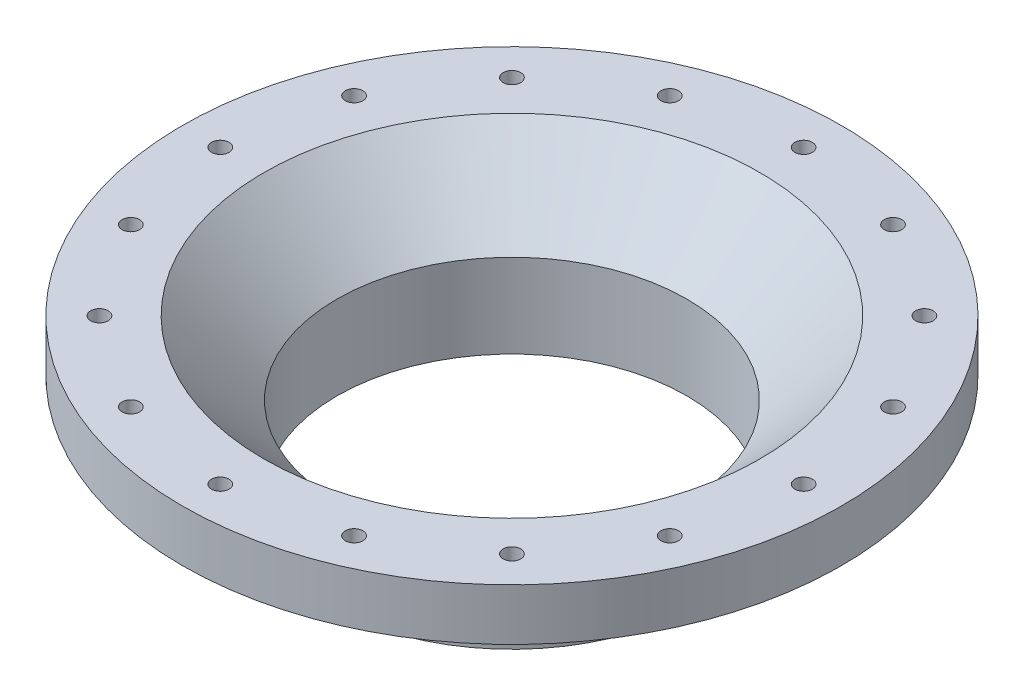
from build123d import *

# Parameters (mm, degrees)
SKETCH1_W               = 1.666666667
SKETCH1_H               = 2.3
SKETCH2_R               = 15
CUT_EXTRUDE2_DEPTH      = 130
FILLET1_R               = 10
SKETCH3_W               = 40
SKETCH3_H               = 40
BOSS_EXTRUDE1_DEPTH     = 60
SKETCH4_R               = 10
CUT_EXTRUDE3_DEPTH      = 340
FILLET2_R               = 20
FILLET3_R               = 10
CUT_EXTRUDE4_DEPTH      = 826.203065437
CUT_EXTRUDE4_DEPTH_BACK = 826.203065437
SKETCH5_W               = 1129.925764392
SKETCH5_H               = 112.630670772
SKETCH7_R               = 1.1


with BuildPart() as part:
    # Sketch1 → Revolve1 (revolve)
    with BuildSketch(Plane.XY, mode=Mode.PRIVATE) as revolve1_sk:
        Polygon((564.962882196, 62.614305474), (425.228610948, 62.614305474), (300, -62.614305474), (300, -206.383096907), (320, -206.383096907), (320, -106.383096907), (318.333333333, -106.383096907), (318.333333333, -104.083096907), (320, -104.083096907), (320, -70.898576722), (364.962882196, -25.935694526), (564.962882196, -25.935694526), align=None)
        with Locations((319.166666667, -55.233096907)):
            Rectangle(SKETCH1_W, SKETCH1_H, mode=Mode.SUBTRACT)
    revolve(revolve1_sk.sketch.rotate(Axis((0, 21.088092429, 0), (0, -1, 0)), 90), axis=Axis((0, 21.088092429, 0), (0, -1, 0)))

    # Sketch2 → Cut-Extrude2 (cut)
    with BuildSketch(Plane(origin=(0, 62.614305474, 0), x_dir=(1, 0, 0), z_dir=(0, 1, 0))):
        with Locations(Location((500, 0, 0), (0, 0, 270))):
            Circle(SKETCH2_R)
        with Locations(Location((461.939766256, -191.341716183, 0), (0, 0, 270))):
            Circle(SKETCH2_R)
        with Locations(Location((353.553390593, -353.553390593, 0), (0, 0, 270))):
            Circle(SKETCH2_R)
        with Locations(Location((191.341716183, -461.939766256, 0), (0, 0, 270))):
            Circle(SKETCH2_R)
        with Locations(Location((0, -500, 0), (0, 0, 270))):
            Circle(SKETCH2_R)
        with Locations(Location((-191.341716183, -461.939766256, 0), (0, 0, 270))):
            Circle(SKETCH2_R)
        with Locations(Location((-353.553390593, -353.553390593, 0), (0, 0, 270))):
            Circle(SKETCH2_R)
        with Locations(Location((-461.939766256, -191.341716183, 0), (0, 0, 270))):
            Circle(SKETCH2_R)
        with Locations(Location((-500, 0, 0), (0, 0, 270))):
            Circle(SKETCH2_R)
        with Locations(Location((-461.939766256, 191.341716183, 0), (0, 0, 270))):
            Circle(SKETCH2_R)
        with Locations(Location((-353.553390593, 353.553390593, 0), (0, 0, 270))):
            Circle(SKETCH2_R)
        with Locations(Location((-191.341716183, 461.939766256, 0), (0, 0, 270))):
            Circle(SKETCH2_R)
        with Locations(Location((0, 500, 0), (0, 0, 270))):
            Circle(SKETCH2_R)
        with Locations(Location((191.341716183, 461.939766256, 0), (0, 0, 270))):
            Circle(SKETCH2_R)
        with Locations(Location((353.553390593, 353.553390593, 0), (0, 0, 270))):
            Circle(SKETCH2_R)
        with Locations(Location((461.939766256, 191.341716183, 0), (0, 0, 270))):
            Circle(SKETCH2_R)
    extrude(amount=-CUT_EXTRUDE2_DEPTH, mode=Mode.SUBTRACT)

    # Fillet1
    fillet1_edges = [part.edges().sort_by_distance(p)[0] for p in [
        (0, -25.935694526, -364.962882196),
        (0, -70.898576722, -320),
    ]]
    fillet(fillet1_edges, radius=FILLET1_R)

    # Sketch3 → Boss-Extrude1 (add)
    with BuildSketch(Plane(origin=(0, 62.614305474, 0), x_dir=(1, 0, 0), z_dir=(0, 1, 0))):
        with Locations((454.852813742, 60)):
            Rectangle(SKETCH3_W, SKETCH3_H)
        with Locations((454.852813742, -60)):
            Rectangle(SKETCH3_W, SKETCH3_H)
    extrude(amount=BOSS_EXTRUDE1_DEPTH)

    # Sketch4 → Cut-Extrude3 (cut)
    with BuildSketch(Plane.XY.offset(80)):
        with Locations((454.852813742, 102.614305474)):
            Circle(SKETCH4_R)
    extrude(amount=-CUT_EXTRUDE3_DEPTH, mode=Mode.SUBTRACT)

    # Fillet2
    fillet2_edges = [part.edges().sort_by_distance(p)[0] for p in [
        (474.852813742, 122.614305474, -60),
        (434.852813742, 122.614305474, -60),
        (434.852813742, 122.614305474, 60),
        (474.852813742, 122.614305474, 60),
    ]]
    fillet(fillet2_edges, radius=FILLET2_R - 0.0001)  # a hair under: the kernel refuses the full size

    # Fillet3
    fillet3_edges = [part.edges().sort_by_distance(p)[0] for p in [
        (474.852813742, 62.614305474, -60),
        (454.852813742, 62.614305474, -80),
        (434.852813742, 62.614305474, -60),
        (454.852813742, 62.614305474, -40),
        (454.852813742, 62.614305474, 40),
        (434.852813742, 62.614305474, 60),
        (454.852813742, 62.614305474, 80),
        (474.852813742, 62.614305474, 60),
    ]]
    fillet(fillet3_edges, radius=FILLET3_R)

    # Sketch5 → Cut-Extrude4 (cut, two sides: drawn at the far end of the back side and taken through both)
    with BuildSketch(Plane(origin=(0, 0, 0), x_dir=(0, 0, -1), z_dir=(1, 0, 0)).offset(-CUT_EXTRUDE4_DEPTH_BACK)):
        with Locations((0, 118.92964086)):
            Rectangle(SKETCH5_W, SKETCH5_H)
    extrude(amount=CUT_EXTRUDE4_DEPTH + CUT_EXTRUDE4_DEPTH_BACK, mode=Mode.SUBTRACT)


with BuildPart() as body_2:
    # Sketch7 → Revolve2 (revolve)
    with BuildSketch(Plane.XY, mode=Mode.PRIVATE) as revolve2_sk:
        with Locations((319.48297917, -85.06515915)):
            Circle(SKETCH7_R)
    revolve(revolve2_sk.sketch.rotate(Axis((0, -35.096451033, 0), (0, -1, 0)), 90), axis=Axis((0, -35.096451033, 0), (0, -1, 0)))


solid = Compound([part.part, body_2.part])
